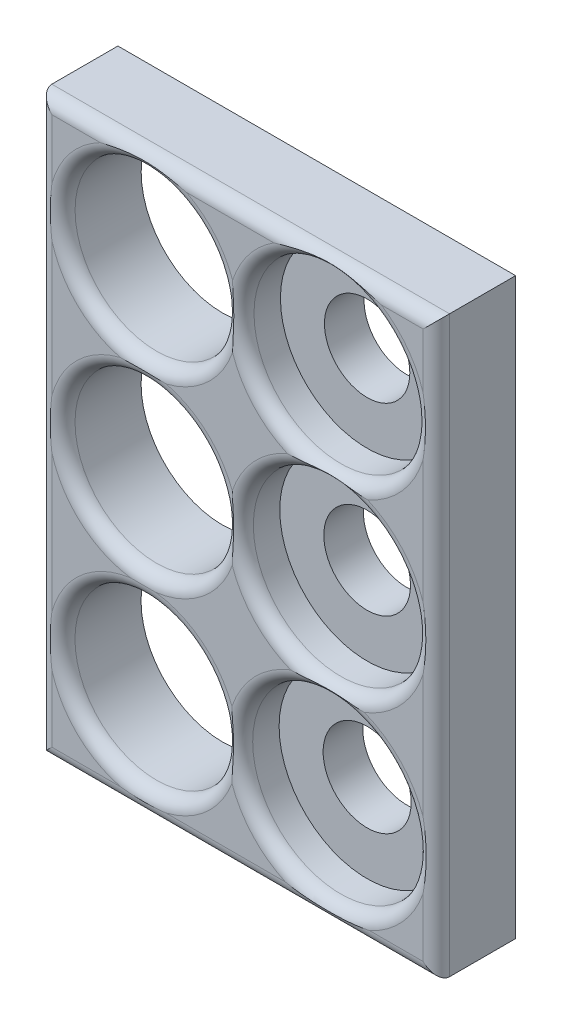
from build123d import *

# Parameters (mm, degrees)
SKETCH1_W           = 30.094242496
SKETCH1_H           = 43.444319995
SKETCH1_R           = 6.66
SKETCH1_R_2         = 6.61
SKETCH1_R_3         = 6.56
SKETCH1_R_4         = 6.17
SKETCH1_R_5         = 6.165
SKETCH1_R_6         = 6.16
BOSS_EXTRUDE1_DEPTH = 3
BOSS_EXTRUDE2_START = -3
SKETCH1_3_W         = 30.094242496
SKETCH1_3_H         = 43.444319995
SKETCH1_3_R         = 6.66
SKETCH1_3_R_2       = 6.61
SKETCH1_3_R_3       = 6.56
SKETCH1_3_R_4       = 6.17
SKETCH1_3_R_5       = 6.165
SKETCH1_3_R_6       = 6.16
SKETCH1_3_R_7       = 3.23
SKETCH1_3_R_8       = 3.28
SKETCH1_3_R_9       = 3.33
BOSS_EXTRUDE2_DEPTH = 3
FILLET1_R           = 1


with BuildPart() as part:
    # Sketch1 → Boss-Extrude1 (new body)
    with BuildSketch(Plane.XY):
        with Locations((-2.99012951, -5.400450282)):
            Rectangle(SKETCH1_W, SKETCH1_H)
        with Locations((3.820672739, -19.157818281)):
            Circle(SKETCH1_R, mode=Mode.SUBTRACT)
        with Locations((3.820672739, -4.947905282)):
            Circle(SKETCH1_R_2, mode=Mode.SUBTRACT)
        with Locations((3.820672739, 8.945226216)):
            Circle(SKETCH1_R_3, mode=Mode.SUBTRACT)
        with Locations((-10.117713259, -19.157818281)):
            Circle(SKETCH1_R_4, mode=Mode.SUBTRACT)
        with Locations((-10.117713259, -4.947905282)):
            Circle(SKETCH1_R_5, mode=Mode.SUBTRACT)
        with Locations((-10.117713259, 8.945226216)):
            Circle(SKETCH1_R_6, mode=Mode.SUBTRACT)
    extrude(amount=BOSS_EXTRUDE1_DEPTH)

    # Sketch1<3> → Boss-Extrude2 (add)
    # profile 1 of 4: a face of its own
    with BuildSketch(Plane.XY.offset(BOSS_EXTRUDE2_START)):
        with Locations((-2.99012951, -5.400450282)):
            Rectangle(SKETCH1_3_W, SKETCH1_3_H)
        with Locations((3.820672739, -19.157818281)):
            Circle(SKETCH1_3_R, mode=Mode.SUBTRACT)
        with Locations((3.820672739, -4.947905282)):
            Circle(SKETCH1_3_R_2, mode=Mode.SUBTRACT)
        with Locations((3.820672739, 8.945226216)):
            Circle(SKETCH1_3_R_3, mode=Mode.SUBTRACT)
        with Locations((-10.117713259, -19.157818281)):
            Circle(SKETCH1_3_R_4, mode=Mode.SUBTRACT)
        with Locations((-10.117713259, -4.947905282)):
            Circle(SKETCH1_3_R_5, mode=Mode.SUBTRACT)
        with Locations((-10.117713259, 8.945226216)):
            Circle(SKETCH1_3_R_6, mode=Mode.SUBTRACT)
    # profile 2 of 4: a face of its own
    with BuildSketch(Plane.XY.offset(BOSS_EXTRUDE2_START)):
        with Locations((3.820672739, 8.945226216)):
            Circle(SKETCH1_3_R_3)
        with Locations((3.820672739, 8.945226216)):
            Circle(SKETCH1_3_R_7, mode=Mode.SUBTRACT)
    # profile 3 of 4: a face of its own
    with BuildSketch(Plane.XY.offset(BOSS_EXTRUDE2_START)):
        with Locations((3.820672739, -4.947905282)):
            Circle(SKETCH1_3_R_2)
        with Locations((3.820672739, -4.947905282)):
            Circle(SKETCH1_3_R_8, mode=Mode.SUBTRACT)
    # profile 4 of 4: a face of its own
    with BuildSketch(Plane.XY.offset(BOSS_EXTRUDE2_START)):
        with Locations((3.820672739, -19.157818281)):
            Circle(SKETCH1_3_R)
        with Locations((3.820672739, -19.157818281)):
            Circle(SKETCH1_3_R_9, mode=Mode.SUBTRACT)
    extrude(amount=BOSS_EXTRUDE2_DEPTH)

    # Fillet1
    # the kernel refuses this fillet: 1 mm, written as the material it takes off along each edge
    with BuildSketch(Plane(origin=(3.820672739, -19.157818281, 3), x_dir=(1, 0, 0), z_dir=(0, -1, 0))) as fillet1_piece_1:
        with BuildLine():
            CenterArc((6.66 + FILLET1_R, -FILLET1_R), FILLET1_R, 90, 90)
            Line((6.66 + FILLET1_R, 0), (6.66, 0))
            Line((6.66, 0), (6.66, -FILLET1_R))
        make_face()
    revolve(axis=Axis((3.820672739, -19.157818281, 3), (0, 0, 1)), mode=Mode.SUBTRACT)
    with BuildSketch(Plane(origin=(3.820672739, -4.947905282, 3), x_dir=(1, 0, 0), z_dir=(0, -1, 0))) as fillet1_piece_2:
        with BuildLine():
            CenterArc((6.61 + FILLET1_R, -FILLET1_R), FILLET1_R, 90, 90)
            Line((6.61 + FILLET1_R, 0), (6.61, 0))
            Line((6.61, 0), (6.61, -FILLET1_R))
        make_face()
    revolve(axis=Axis((3.820672739, -4.947905282, 3), (0, 0, 1)), mode=Mode.SUBTRACT)
    with BuildSketch(Plane(origin=(3.820672739, 8.945226216, 3), x_dir=(1, 0, 0), z_dir=(0, -1, 0))) as fillet1_piece_3:
        with BuildLine():
            CenterArc((6.56 + FILLET1_R, -FILLET1_R), FILLET1_R, 90, 90)
            Line((6.56 + FILLET1_R, 0), (6.56, 0))
            Line((6.56, 0), (6.56, -FILLET1_R))
        make_face()
    revolve(axis=Axis((3.820672739, 8.945226216, 3), (0, 0, 1)), mode=Mode.SUBTRACT)
    with BuildSketch(Plane(origin=(-10.117713259, -19.157818281, 3), x_dir=(1, 0, 0), z_dir=(0, -1, 0))) as fillet1_piece_4:
        with BuildLine():
            CenterArc((6.17 + FILLET1_R, -FILLET1_R), FILLET1_R, 90, 90)
            Line((6.17 + FILLET1_R, 0), (6.17, 0))
            Line((6.17, 0), (6.17, -FILLET1_R))
        make_face()
    revolve(axis=Axis((-10.117713259, -19.157818281, 3), (0, 0, 1)), mode=Mode.SUBTRACT)
    with BuildSketch(Plane(origin=(-10.117713259, -4.947905282, 3), x_dir=(1, 0, 0), z_dir=(0, -1, 0))) as fillet1_piece_5:
        with BuildLine():
            CenterArc((6.165 + FILLET1_R, -FILLET1_R), FILLET1_R, 90, 90)
            Line((6.165 + FILLET1_R, 0), (6.165, 0))
            Line((6.165, 0), (6.165, -FILLET1_R))
        make_face()
    revolve(axis=Axis((-10.117713259, -4.947905282, 3), (0, 0, 1)), mode=Mode.SUBTRACT)
    with BuildSketch(Plane(origin=(-10.117713259, 8.945226216, 3), x_dir=(1, 0, 0), z_dir=(0, -1, 0))) as fillet1_piece_6:
        with BuildLine():
            CenterArc((6.16 + FILLET1_R, -FILLET1_R), FILLET1_R, 90, 90)
            Line((6.16 + FILLET1_R, 0), (6.16, 0))
            Line((6.16, 0), (6.16, -FILLET1_R))
        make_face()
    revolve(axis=Axis((-10.117713259, 8.945226216, 3), (0, 0, 1)), mode=Mode.SUBTRACT)
    with BuildSketch(Plane(origin=(12.056991738, 18.821709715, 3), x_dir=(0, 0, -1), z_dir=(0, -1, 0)), Plane(origin=(-18.037250758, -29.62261028, 3), x_dir=(0, 0, -1), z_dir=(0, 1, 0))) as fillet1_piece_7:
        with BuildLine():
            CenterArc((FILLET1_R, -FILLET1_R), FILLET1_R, 90, 90)
            Line((0, -FILLET1_R), (0, 0))
            Line((0, 0), (FILLET1_R, 0))
        make_face()
    extrude(amount=48.444319995, mode=Mode.SUBTRACT)
    with BuildSketch(Plane(origin=(-20.537250758, 16.321709715, 3), x_dir=(0, 0, -1), z_dir=(1, 0, 0)), Plane(origin=(14.556991738, -27.12261028, 3), x_dir=(0, 0, -1), z_dir=(-1, 0, 0))) as fillet1_piece_8:
        with BuildLine():
            CenterArc((FILLET1_R, -FILLET1_R), FILLET1_R, 90, 90)
            Line((0, -FILLET1_R), (0, 0))
            Line((0, 0), (FILLET1_R, 0))
        make_face()
    extrude(amount=35.094242496, mode=Mode.SUBTRACT)


solid = part.part
